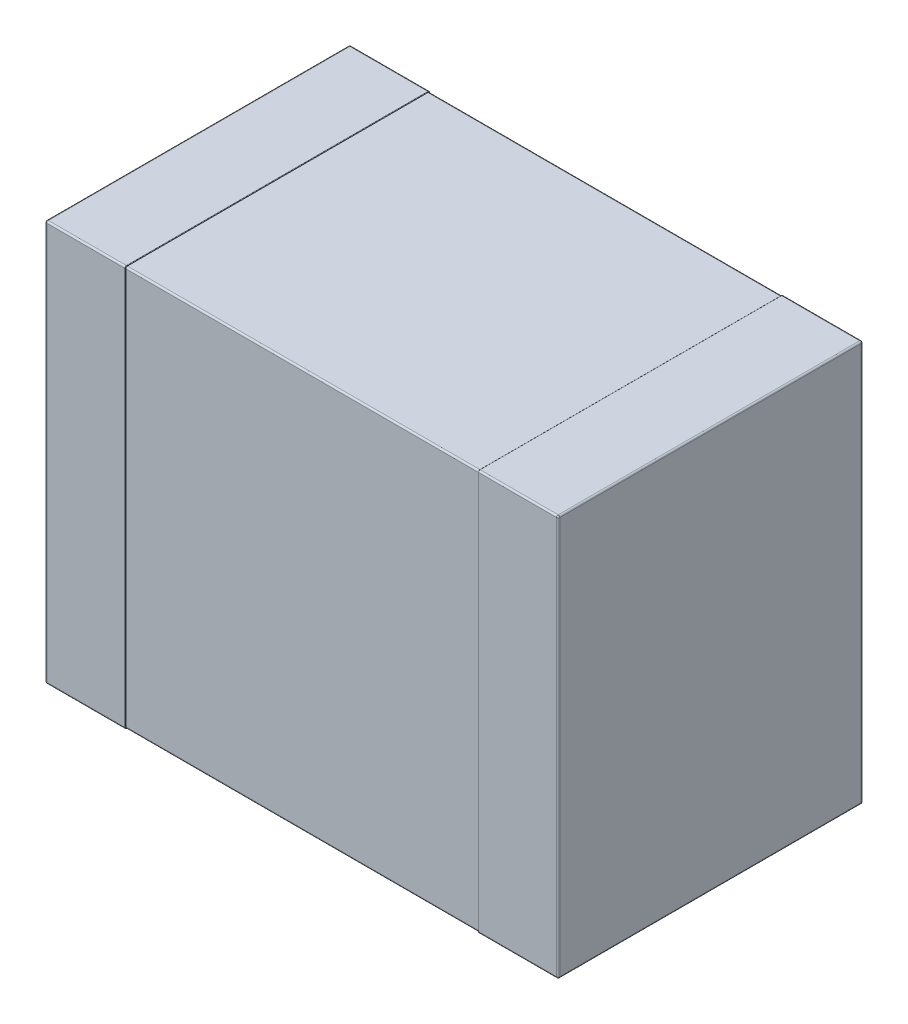
from build123d import *

# Parameters (mm, degrees)
SKETCH1_W                           = 3.2
SKETCH1_H                           = 2.5
ALL_BODY_DEPTH                      = 1.9
CUT_OUT_THE_BODY_FOR_PIN_DEPTH      = 1.1
CUT_OUT_THE_BODY_FOR_PIN_DEPTH_BACK = 1.1
SKETCH2_OUTSIDE_W                   = 4.796
SKETCH2_OUTSIDE_H                   = 5.396
SKETCH2_OUTSIDE_W_2                 = 1.894
SKETCH2_OUTSIDE_H_2                 = 2.494
BODY_FILLET_R                       = 0.01
PIN_FILLET_A_R                      = 0.01
PIN_FILLET_B_R                      = 0.003


with BuildPart() as part:
    # Sketch1 → All body (new body)
    with BuildSketch(Plane.XY):
        Rectangle(SKETCH1_W, SKETCH1_H)
    extrude(amount=ALL_BODY_DEPTH)

    # Sketch2 outside → Cut out the body for pin (cut, two sides: drawn at the far end of the back side and taken through both)
    with BuildSketch(Plane(origin=(0, 0, 0), x_dir=(0, 0, -1), z_dir=(1, 0, 0)).offset(-CUT_OUT_THE_BODY_FOR_PIN_DEPTH_BACK)):
        with Locations((-0.95, 0)):
            Rectangle(SKETCH2_OUTSIDE_W, SKETCH2_OUTSIDE_H)
        with Locations((-0.95, 0)):
            Rectangle(SKETCH2_OUTSIDE_W_2, SKETCH2_OUTSIDE_H_2, mode=Mode.SUBTRACT)
    extrude(amount=CUT_OUT_THE_BODY_FOR_PIN_DEPTH + CUT_OUT_THE_BODY_FOR_PIN_DEPTH_BACK, mode=Mode.SUBTRACT)

    # Body fillet
    body_fillet_edges = [part.edges().sort_by_distance(p)[0] for p in [
        (0, 1.247, 0.003),
        (0, 1.247, 1.897),
        (0, -1.247, 1.897),
        (0, -1.247, 0.003),
    ]]
    fillet(body_fillet_edges, radius=BODY_FILLET_R)

    # Pin fillet a
    pin_fillet_a_edges = [part.edges().sort_by_distance(p)[0] for p in [
        (1.6, 0, 1.9),
        (-1.35, 1.25, 0),
        (1.35, -1.25, 0),
        (1.35, -1.25, 1.9),
        (-1.35, 1.25, 1.9),
        (1.35, 1.25, 1.9),
        (-1.6, 0, 1.9),
        (1.35, 1.25, 0),
        (1.6, 0, 0),
        (-1.35, -1.25, 0),
        (-1.6, 0, 0),
        (-1.6, 1.25, 0.95),
        (1.6, 1.25, 0.95),
        (1.6, -1.25, 0.95),
        (-1.6, -1.25, 0.95),
        (-1.35, -1.25, 1.9),
    ]]
    fillet(pin_fillet_a_edges, radius=PIN_FILLET_A_R)

    # Pin fillet b
    pin_fillet_b_edges = [part.edges().sort_by_distance(p)[0] for p in [
        (1.1, -1.25, 0.95),
        (1.1, 0, 1.9),
        (1.1, 1.25, 0.95),
        (1.1, 0, 0),
        (-1.1, 1.25, 0.95),
        (-1.1, 0, 1.9),
        (-1.1, -1.25, 0.95),
        (-1.1, 0, 0),
        (1.1, 1.247071068, 0.002928932),
        (1.1, -1.247071068, 0.002928932),
        (1.1, -1.247071068, 1.897071068),
        (1.1, 1.247071068, 1.897071068),
        (-1.1, -1.247071068, 1.897071068),
        (-1.1, 1.247071068, 1.897071068),
        (-1.1, -1.247071068, 0.002928932),
        (-1.1, 1.247071068, 0.002928932),
    ]]
    fillet(pin_fillet_b_edges, radius=PIN_FILLET_B_R - 0.0001)  # a hair under: the kernel refuses the full size


solid = part.part
